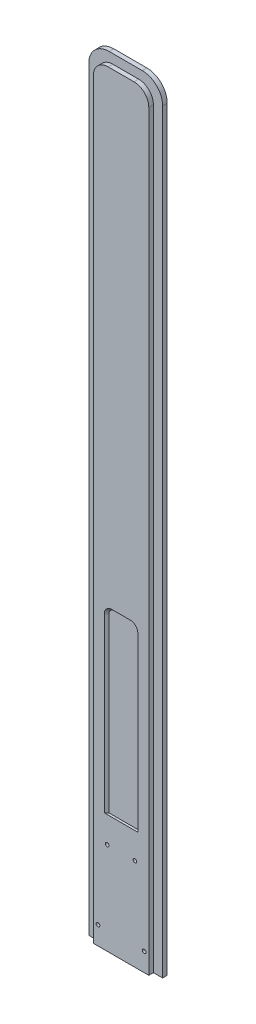
from build123d import *

# Parameters (mm, degrees)
BOSS_EXTRUDE2_DEPTH     = 1.5875
SKETCH2_W               = 38.1
SKETCH2_H               = 76.2
BOSS_EXTRUDE3_DEPTH     = 4.7625
CUT_EXTRUDE1_DEPTH      = 1.5875
CHAMFER1_SIZE           = 2
CUT_EXTRUDE2_DEPTH      = 306.117964892
CUT_EXTRUDE2_DEPTH_BACK = 306.117964892
SKETCH4_R               = 1.25


with BuildPart() as part:
    # Sketch1 → Boss-Extrude2 (new, symmetric)
    with BuildSketch(Plane.XY.offset(250.46101)):
        with BuildLine():
            Line((-62.9, 238.2), (-40.1, 238.2))
            ThreePointArc((-40.1, 238.2), (-30.200505063, 234.099494937), (-26.1, 224.2))
            Line((-26.1, 224.2), (-26.1, -219))
            Line((-26.1, -219), (-26.1, -295.2))
            Line((-26.1, -295.2), (-76.9, -295.2))
            Line((-76.9, -295.2), (-76.9, -219))
            Line((-76.9, -219), (-76.9, 224.2))
            ThreePointArc((-76.9, 224.2), (-72.799494937, 234.099494937), (-62.9, 238.2))
        make_face()
    extrude(amount=BOSS_EXTRUDE2_DEPTH, both=True)

    # Sketch2 → Boss-Extrude3 (add, symmetric)
    with BuildSketch(Plane.XY.offset(250.46101)):
        with Locations((-51.5, -257.1)):
            Rectangle(SKETCH2_W, SKETCH2_H)
        with BuildLine():
            Line((-60.39, 231.85), (-42.61, 231.85))
            ThreePointArc((-42.61, 231.85), (-35.425795103, 228.874204897), (-32.45, 221.69))
            Line((-32.45, 221.69), (-32.45, -219))
            Line((-32.45, -219), (-70.55, -219))
            Line((-70.55, -219), (-70.55, 221.69))
            ThreePointArc((-70.55, 221.69), (-67.574204897, 228.874204897), (-60.39, 231.85))
        make_face()
    extrude(amount=BOSS_EXTRUDE3_DEPTH, both=True)

    # Sketch3 → Cut-Extrude1 (cut)
    with BuildSketch(Plane.XY.offset(255.22351)):
        with BuildLine():
            Line((-61.025, -95.175), (-61.025, -213.725))
            Line((-61.025, -213.725), (-41.975, -213.725))
            Line((-41.975, -213.725), (-41.975, -95.175))
            ThreePointArc((-41.975, -95.175), (-42.90493597, -92.92993597), (-45.15, -92))
            Line((-45.15, -92), (-57.85, -92))
            ThreePointArc((-57.85, -92), (-60.09506403, -92.92993597), (-61.025, -95.175))
        make_face()
    cut_extrude1 = extrude(amount=-CUT_EXTRUDE1_DEPTH, mode=Mode.SUBTRACT)

    # Mirror2: Cut-Extrude1 across plane
    add(cut_extrude1.mirror(Plane.XY.offset(250.46101)), mode=Mode.SUBTRACT)

    # Chamfer1
    # the kernel refuses this chamfer: 2 mm, written as the material it takes off along each edge
    with BuildSketch(Plane(origin=(-41.975, -213.725, 255.22351), x_dir=(0.999621916911297, 0, 0.0274958766105822), z_dir=(0, 1, 0))) as chamfer1_piece_1_section:
        Polygon((CHAMFER1_SIZE * 0.999621916911, CHAMFER1_SIZE * 0.0274958766106), (-CHAMFER1_SIZE * 0.0274958766106, CHAMFER1_SIZE * 0.999621916911), (0, 0), align=None)
    chamfer1_piece_1 = extrude(amount=118.55, mode=Mode.PRIVATE)
    chamfer1_piece_1 = split(chamfer1_piece_1, bisect_by=Plane(origin=(-41.282092609, -154.45, 253.63601), z_dir=(0, 0, 1)), keep=Keep.TOP, mode=Mode.PRIVATE)
    add(chamfer1_piece_1, mode=Mode.SUBTRACT)
    with BuildSketch(Plane(origin=(-61.025, -95.175, 255.22351), x_dir=(-0.999621916911297, 0, 0.0274958766105822), z_dir=(0, -1, 0))) as chamfer1_piece_2_section:
        Polygon((CHAMFER1_SIZE * 0.999621916911, CHAMFER1_SIZE * 0.0274958766106), (-CHAMFER1_SIZE * 0.0274958766106, CHAMFER1_SIZE * 0.999621916911), (0, 0), align=None)
    chamfer1_piece_2 = extrude(amount=118.55, mode=Mode.PRIVATE)
    chamfer1_piece_2 = split(chamfer1_piece_2, bisect_by=Plane(origin=(-61.717907391, -154.45, 253.63601), z_dir=(0, 0, 1)), keep=Keep.TOP, mode=Mode.PRIVATE)
    add(chamfer1_piece_2, mode=Mode.SUBTRACT)
    with BuildSketch(Plane(origin=(-45.15, -95.175, 255.22351), x_dir=(1, 0, 0), z_dir=(0, -1, 0))) as chamfer1_piece_3_section:
        Polygon((3.175 + CHAMFER1_SIZE, 0), (3.175, -CHAMFER1_SIZE), (3.175, 0), align=None)
    chamfer1_piece_3 = revolve(axis=Axis((-45.15, -95.175, 255.22351), (0, 0, 1)), revolution_arc=90, mode=Mode.PRIVATE)
    chamfer1_piece_3 = split(chamfer1_piece_3, bisect_by=Plane(origin=(-42.646845167, -92.671845167, 253.63601), z_dir=(0, 0, 1)), keep=Keep.TOP, mode=Mode.PRIVATE)
    add(chamfer1_piece_3, mode=Mode.SUBTRACT)
    with BuildSketch(Plane(origin=(-57.85, -95.175, 255.22351), x_dir=(0, 1, 0), z_dir=(1, 0, 0))) as chamfer1_piece_4_section:
        Polygon((3.175 + CHAMFER1_SIZE, 0), (3.175, -CHAMFER1_SIZE), (3.175, 0), align=None)
    chamfer1_piece_4 = revolve(axis=Axis((-57.85, -95.175, 255.22351), (0, 0, 1)), revolution_arc=90, mode=Mode.PRIVATE)
    chamfer1_piece_4 = split(chamfer1_piece_4, bisect_by=Plane(origin=(-60.353154832, -92.671845168, 253.63601), z_dir=(0, 0, 1)), keep=Keep.TOP, mode=Mode.PRIVATE)
    add(chamfer1_piece_4, mode=Mode.SUBTRACT)
    with BuildSketch(Plane(origin=(-45.15, -92, 255.22351), x_dir=(0, 0.999621916911297, 0.027495876610582105), z_dir=(-1, 0, 0))) as chamfer1_piece_5_section:
        Polygon((CHAMFER1_SIZE * 0.999621916911, CHAMFER1_SIZE * 0.0274958766106), (-CHAMFER1_SIZE * 0.0274958766106, CHAMFER1_SIZE * 0.999621916911), (0, 0), align=None)
    chamfer1_piece_5 = extrude(amount=12.7, mode=Mode.PRIVATE)
    chamfer1_piece_5 = split(chamfer1_piece_5, bisect_by=Plane(origin=(-51.5, -91.307092609, 253.63601), z_dir=(0, 0, 1)), keep=Keep.TOP, mode=Mode.PRIVATE)
    add(chamfer1_piece_5, mode=Mode.SUBTRACT)
    with BuildSketch(Plane(origin=(-41.975, -213.725, 245.69851), x_dir=(0.999621916911297, 0, -0.0274958766105822), z_dir=(0, 1, 0))) as chamfer1_piece_6_section:
        Polygon((CHAMFER1_SIZE * 0.999621916911, -CHAMFER1_SIZE * 0.0274958766106), (-CHAMFER1_SIZE * 0.0274958766106, -CHAMFER1_SIZE * 0.999621916911), (0, 0), align=None)
    chamfer1_piece_6 = extrude(amount=118.55, mode=Mode.PRIVATE)
    chamfer1_piece_6 = split(chamfer1_piece_6, bisect_by=Plane(origin=(-41.282092609, -154.45, 247.28601), z_dir=(0, 0, -1)), keep=Keep.TOP, mode=Mode.PRIVATE)
    add(chamfer1_piece_6, mode=Mode.SUBTRACT)
    with BuildSketch(Plane(origin=(-61.025, -95.175, 245.69851), x_dir=(-0.999621916911297, 0, -0.0274958766105822), z_dir=(0, -1, 0))) as chamfer1_piece_7_section:
        Polygon((CHAMFER1_SIZE * 0.999621916911, -CHAMFER1_SIZE * 0.0274958766106), (-CHAMFER1_SIZE * 0.0274958766106, -CHAMFER1_SIZE * 0.999621916911), (0, 0), align=None)
    chamfer1_piece_7 = extrude(amount=118.55, mode=Mode.PRIVATE)
    chamfer1_piece_7 = split(chamfer1_piece_7, bisect_by=Plane(origin=(-61.717907391, -154.45, 247.28601), z_dir=(0, 0, -1)), keep=Keep.TOP, mode=Mode.PRIVATE)
    add(chamfer1_piece_7, mode=Mode.SUBTRACT)
    with BuildSketch(Plane(origin=(-45.15, -95.175, 245.69851), x_dir=(1, 0, 0), z_dir=(0, -1, 0))) as chamfer1_piece_8_section:
        Polygon((3.175 + CHAMFER1_SIZE, 0), (3.175, CHAMFER1_SIZE), (3.175, 0), align=None)
    chamfer1_piece_8 = revolve(axis=Axis((-45.15, -95.175, 245.69851), (0, 0, 1)), revolution_arc=90, mode=Mode.PRIVATE)
    chamfer1_piece_8 = split(chamfer1_piece_8, bisect_by=Plane(origin=(-42.646845167, -92.671845167, 247.28601), z_dir=(0, 0, -1)), keep=Keep.TOP, mode=Mode.PRIVATE)
    add(chamfer1_piece_8, mode=Mode.SUBTRACT)
    with BuildSketch(Plane(origin=(-57.85, -95.175, 245.69851), x_dir=(0, 1, 0), z_dir=(1, 0, 0))) as chamfer1_piece_9_section:
        Polygon((3.175 + CHAMFER1_SIZE, 0), (3.175, CHAMFER1_SIZE), (3.175, 0), align=None)
    chamfer1_piece_9 = revolve(axis=Axis((-57.85, -95.175, 245.69851), (0, 0, 1)), revolution_arc=90, mode=Mode.PRIVATE)
    chamfer1_piece_9 = split(chamfer1_piece_9, bisect_by=Plane(origin=(-60.353154832, -92.671845168, 247.28601), z_dir=(0, 0, -1)), keep=Keep.TOP, mode=Mode.PRIVATE)
    add(chamfer1_piece_9, mode=Mode.SUBTRACT)
    with BuildSketch(Plane(origin=(-45.15, -92, 245.69851), x_dir=(0, 0.999621916911297, -0.027495876610582105), z_dir=(-1, 0, 0))) as chamfer1_piece_10_section:
        Polygon((CHAMFER1_SIZE * 0.999621916911, -CHAMFER1_SIZE * 0.0274958766106), (-CHAMFER1_SIZE * 0.0274958766106, -CHAMFER1_SIZE * 0.999621916911), (0, 0), align=None)
    chamfer1_piece_10 = extrude(amount=12.7, mode=Mode.PRIVATE)
    chamfer1_piece_10 = split(chamfer1_piece_10, bisect_by=Plane(origin=(-51.5, -91.307092609, 247.28601), z_dir=(0, 0, -1)), keep=Keep.TOP, mode=Mode.PRIVATE)
    add(chamfer1_piece_10, mode=Mode.SUBTRACT)

    # Sketch4 → Cut-Extrude2 (cut, two sides: drawn at the far end of the back side and taken through both)
    with BuildSketch(Plane.XY.offset(252.04851).offset(-CUT_EXTRUDE2_DEPTH_BACK)):
        with Locations((-61.025, -231.7)):
            Circle(SKETCH4_R)
        with Locations((-41.975, -231.7)):
            Circle(SKETCH4_R)
        with Locations((-35.625, -282.5)):
            Circle(SKETCH4_R)
        with Locations((-67.375, -282.5)):
            Circle(SKETCH4_R)
    extrude(amount=CUT_EXTRUDE2_DEPTH + CUT_EXTRUDE2_DEPTH_BACK, mode=Mode.SUBTRACT)


solid = part.part
